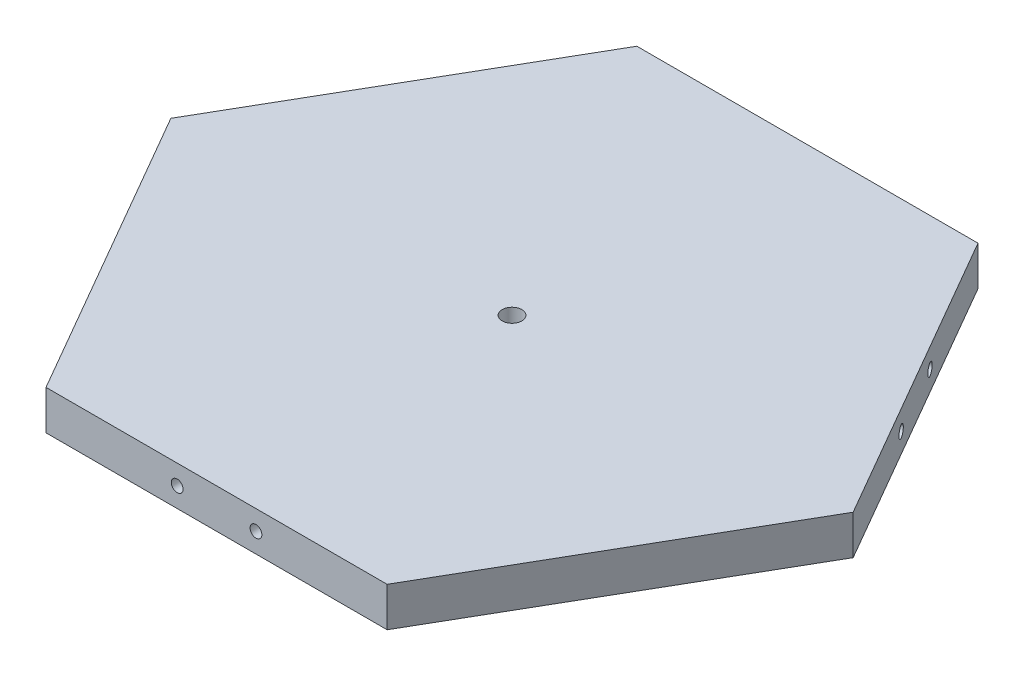
from build123d import *

# Parameters (mm, degrees)
BOSS_EXTRUDE1_DEPTH = 10
SKETCH2_R           = 1.5
CUT_EXTRUDE1_DEPTH  = 10
SKETCH3_R           = 2.5
CUT_EXTRUDE2_DEPTH  = 10
CIRPATTERN1_COUNT   = 3


with BuildPart() as part:
    # Sketch1 → Boss-Extrude1 (new body)
    with BuildSketch(Plane(origin=(0, 0, 0), x_dir=(1, 0, 0), z_dir=(0, 1, 0))):
        Polygon((86.602540378, 0), (43.301270189, 75), (-43.301270189, 75), (-86.602540378, 0), (-43.301270189, -75), (43.301270189, -75), align=None)
    extrude(amount=BOSS_EXTRUDE1_DEPTH)

    # Sketch2 → Cut-Extrude1 (cut)
    with BuildSketch(Plane.XY.offset(75)):
        with Locations((-10, 5)):
            Circle(SKETCH2_R)
        with Locations((10, 5)):
            Circle(SKETCH2_R)
    cut_extrude1 = extrude(amount=-CUT_EXTRUDE1_DEPTH, mode=Mode.SUBTRACT)

    # Sketch3 → Cut-Extrude2 (cut)
    with BuildSketch(Plane(origin=(0, 10, 0), x_dir=(1, 0, 0), z_dir=(0, 1, 0))):
        Circle(SKETCH3_R)
    extrude(amount=-CUT_EXTRUDE2_DEPTH, mode=Mode.SUBTRACT)

    # CirPattern1: Cut-Extrude1 ×3 about axis
    cirpattern1_axis = Axis((0, 0, 0), (0, 1, 0))
    for i in range(1, CIRPATTERN1_COUNT):
        add(cut_extrude1.rotate(cirpattern1_axis, i * 360 / CIRPATTERN1_COUNT), mode=Mode.SUBTRACT)


solid = part.part
